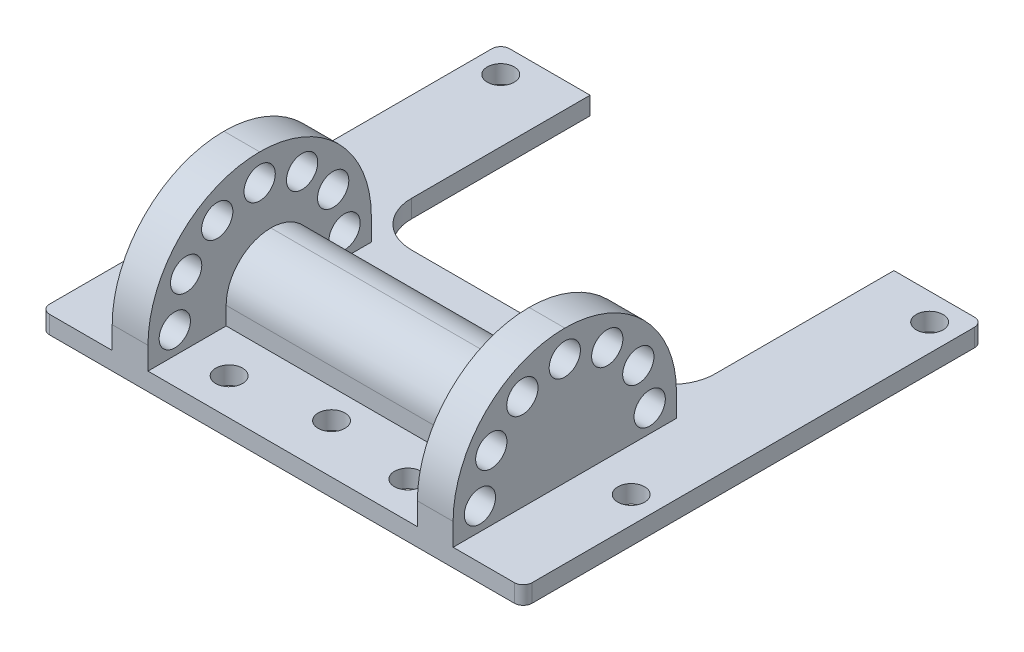
from build123d import *

# Parameters (mm, degrees)
SKETCH1_R                       = 1.5
BOSS_EXTRUDE1_DEPTH             = 2
SKETCH2_W                       = 4
SKETCH2_H                       = 25
BOSS_EXTRUDE2_DEPTH             = 15
FILLET1_R                       = 12.5
SKETCH3_R                       = 1.75
CUT_EXTRUDE3_DEPTH              = 53.391713426
CIRPATTERN1_COUNT               = 4
CIRPATTERN1_ANGLE               = 90
CIRPATTERN1_THE_OTHER_WAY_COUNT = 4
CIRPATTERN1_THE_OTHER_WAY_ANGLE = 90
MIRROR1_COPY_1_SKETCH_R         = 1.75
MIRROR1_COPY_1_DEPTH            = 53.391713426
MIRROR1_COPY_2_SKETCH_R         = 1.75
MIRROR1_COPY_2_DEPTH            = 53.391713426
MIRROR1_COPY_3_SKETCH_R         = 1.75
MIRROR1_COPY_3_DEPTH            = 53.391713426
MIRROR1_COPY_4_SKETCH_R         = 1.75
MIRROR1_COPY_4_DEPTH            = 53.391713426
MIRROR1_COPY_5_SKETCH_R         = 1.75
MIRROR1_COPY_5_DEPTH            = 53.391713426
MIRROR1_COPY_6_SKETCH_R         = 1.75
MIRROR1_COPY_6_DEPTH            = 53.391713426
FILLET1_OF_MIRROR1_R            = 12.5
SKETCH4_W                       = 30.151429758
SKETCH4_H                       = 10
BOSS_EXTRUDE3_DEPTH             = 7
FILLET2_R                       = 5


with BuildPart() as part:
    # Sketch1 → Boss-Extrude1 (new body)
    with BuildSketch(Plane(origin=(0, 0, 0), x_dir=(1, 0, 0), z_dir=(0, 1, 0))):
        with BuildLine():
            Line((-17.075714879, 5.179541619), (-17.075714879, 25.179541619))
            Line((-17.075714879, 25.179541619), (-26.075714879, 25.179541619))
            ThreePointArc((-26.075714879, 25.179541619), (-26.782821661, 24.8866484), (-27.075714879, 24.179541619))
            Line((-27.075714879, 24.179541619), (-27.075714879, -25.303833099))
            ThreePointArc((-27.075714879, -25.303833099), (-26.782821661, -26.010939881), (-26.075714879, -26.303833099))
            Line((-26.075714879, -26.303833099), (25.924285121, -26.303833099))
            ThreePointArc((25.924285121, -26.303833099), (26.631391902, -26.010939881), (26.924285121, -25.303833099))
            Line((26.924285121, -25.303833099), (26.924285121, 24.179541619))
            ThreePointArc((26.924285121, 24.179541619), (26.631391902, 24.8866484), (25.924285121, 25.179541619))
            Line((25.924285121, 25.179541619), (16.924285121, 25.179541619))
            Line((16.924285121, 25.179541619), (16.924285121, 5.179541619))
            ThreePointArc((16.924285121, 5.179541619), (15.459819027, 1.644007713), (11.924285121, 0.179541619))
            Line((11.924285121, 0.179541619), (-12.075714879, 0.179541619))
            ThreePointArc((-12.075714879, 0.179541619), (-15.611248785, 1.644007713), (-17.075714879, 5.179541619))
        make_face()
        with Locations(Location((-24.075714879, 22.179541619, 0), (0, 0, 270))):
            Circle(SKETCH1_R, mode=Mode.SUBTRACT)
        with Locations(Location((23.924285121, 22.179541619, 0), (0, 0, 270))):
            Circle(SKETCH1_R, mode=Mode.SUBTRACT)
        with Locations(Location((-24.075714879, -11.220458381, 0), (0, 0, 270))):
            Circle(SKETCH1_R, mode=Mode.SUBTRACT)
        with Locations(Location((-10.075714879, -22.220458381, 0), (0, 0, 270))):
            Circle(SKETCH1_R, mode=Mode.SUBTRACT)
        with Locations(Location((9.924285121, -22.220458381, 0), (0, 0, 270))):
            Circle(SKETCH1_R, mode=Mode.SUBTRACT)
        with Locations(Location((0, -20.835125629, 0), (0, 0, 270))):
            Circle(SKETCH1_R, mode=Mode.SUBTRACT)
        with Locations(Location((23.924285121, -11.220458381, 0), (0, 0, 270))):
            Circle(SKETCH1_R, mode=Mode.SUBTRACT)
    extrude(amount=BOSS_EXTRUDE1_DEPTH)

    # Sketch2 → Boss-Extrude2 (add)
    with BuildSketch(Plane(origin=(0, 2, 0), x_dir=(1, 0, 0), z_dir=(0, 1, 0))):
        with Locations((-17.075714879, -13.803833099)):
            Rectangle(SKETCH2_W, SKETCH2_H)
    boss_extrude2 = extrude(amount=BOSS_EXTRUDE2_DEPTH)

    # Fillet1
    fillet1_edges = [part.edges().sort_by_distance(p)[0] for p in [
        (-17.075714879, 17, 26.303833099),
        (-17.075714879, 17, 1.303833099),
    ]]
    fillet(fillet1_edges, radius=FILLET1_R - 0.0001)  # a hair under: the kernel refuses the full size

    # Sketch3 → Cut-Extrude3 (cut, through all)
    with BuildSketch(Plane(origin=(-15.075714879, 0, 0), x_dir=(0, 0, -1), z_dir=(1, 0, 0))):
        with Locations((-13.803833099, 14)):
            Circle(SKETCH3_R)
    cut_extrude3 = extrude(amount=-CUT_EXTRUDE3_DEPTH, mode=Mode.SUBTRACT)

    # CirPattern1: Cut-Extrude3 ×4 about axis
    cirpattern1_axis = Axis((0, 4.5, 13.803833099), (1, 0, 0))
    for i in range(1, CIRPATTERN1_COUNT):
        add(cut_extrude3.rotate(cirpattern1_axis, i * CIRPATTERN1_ANGLE / (CIRPATTERN1_COUNT - 1)), mode=Mode.SUBTRACT)

    # CirPattern1 the other way: Cut-Extrude3 ×4 about axis
    cirpattern1_the_other_way_axis = Axis((0, 4.5, 13.803833099), (-1, 0, 0))
    for i in range(1, CIRPATTERN1_THE_OTHER_WAY_COUNT):
        add(cut_extrude3.rotate(cirpattern1_the_other_way_axis, i * CIRPATTERN1_THE_OTHER_WAY_ANGLE / (CIRPATTERN1_THE_OTHER_WAY_COUNT - 1)), mode=Mode.SUBTRACT)

    # Mirror1: Boss-Extrude2, Cut-Extrude3 across plane
    add(boss_extrude2.mirror(Plane(origin=(0, 0, 0), x_dir=(0, 0, 1), z_dir=(1, 0, 0))))
    add(cut_extrude3.mirror(Plane(origin=(0, 0, 0), x_dir=(0, 0, 1), z_dir=(1, 0, 0))), mode=Mode.SUBTRACT)

    # Mirror1 copy 1 sketch → Mirror1 copy 1 (cut, through all)
    with BuildSketch(Plane(origin=(15.075714879, 7.504802233, -0.400637034), x_dir=(0, 0.5000000000000008, -0.8660254037844382), z_dir=(-1, 0, 0))):
        with Locations((-13.803833099, -14)):
            Circle(MIRROR1_COPY_1_SKETCH_R)
    extrude(amount=-MIRROR1_COPY_1_DEPTH, mode=Mode.SUBTRACT)

    # Mirror1 copy 2 sketch → Mirror1 copy 2 (cut, through all)
    with BuildSketch(Plane(origin=(15.075714879, 14.204470134, 3.004802233), x_dir=(0, 0.8660254037844396, -0.4999999999999984), z_dir=(-1, 0, 0))):
        with Locations((-13.803833099, -14)):
            Circle(MIRROR1_COPY_2_SKETCH_R)
    extrude(amount=-MIRROR1_COPY_2_DEPTH, mode=Mode.SUBTRACT)

    # Mirror1 copy 3 sketch → Mirror1 copy 3 (cut, through all)
    with BuildSketch(Plane(origin=(15.075714879, 18.303833099, 9.303833099), x_dir=(0, 1, 0), z_dir=(-1, 0, 0))):
        with Locations((-13.803833099, -14)):
            Circle(MIRROR1_COPY_3_SKETCH_R)
    extrude(amount=-MIRROR1_COPY_3_DEPTH, mode=Mode.SUBTRACT)

    # Mirror1 copy 4 sketch → Mirror1 copy 4 (cut, through all)
    with BuildSketch(Plane(origin=(15.075714879, -6.299030867, 4.099362966), x_dir=(0, -0.5000000000000008, -0.8660254037844382), z_dir=(-1, 0, 0))):
        with Locations((-13.803833099, -14)):
            Circle(MIRROR1_COPY_4_SKETCH_R)
    extrude(amount=-MIRROR1_COPY_4_DEPTH, mode=Mode.SUBTRACT)

    # Mirror1 copy 5 sketch → Mirror1 copy 5 (cut, through all)
    with BuildSketch(Plane(origin=(15.075714879, -9.704470134, 10.799030867), x_dir=(0, -0.8660254037844396, -0.4999999999999984), z_dir=(-1, 0, 0))):
        with Locations((-13.803833099, -14)):
            Circle(MIRROR1_COPY_5_SKETCH_R)
    extrude(amount=-MIRROR1_COPY_5_DEPTH, mode=Mode.SUBTRACT)

    # Mirror1 copy 6 sketch → Mirror1 copy 6 (cut, through all)
    with BuildSketch(Plane(origin=(15.075714879, -9.303833099, 18.303833099), x_dir=(0, -1, 0), z_dir=(-1, 0, 0))):
        with Locations((-13.803833099, -14)):
            Circle(MIRROR1_COPY_6_SKETCH_R)
    extrude(amount=-MIRROR1_COPY_6_DEPTH, mode=Mode.SUBTRACT)

    # Fillet1 of Mirror1
    fillet1_of_mirror1_edges = [part.edges().sort_by_distance(p)[0] for p in [
        (17.075714879, 17, 26.303833099),
        (17.075714879, 17, 1.303833099),
    ]]
    fillet(fillet1_of_mirror1_edges, radius=FILLET1_OF_MIRROR1_R - 0.0001)  # a hair under: the kernel refuses the full size

    # Sketch4 → Boss-Extrude3 (add)
    with BuildSketch(Plane(origin=(0, 2, 0), x_dir=(1, 0, 0), z_dir=(0, 1, 0))):
        with Locations((0, -12.553833099)):
            Rectangle(SKETCH4_W, SKETCH4_H)
    extrude(amount=BOSS_EXTRUDE3_DEPTH)

    # Fillet2
    fillet2_edges = [part.edges().sort_by_distance(p)[0] for p in [
        (0, 9, 17.553833099),
        (0, 9, 7.553833099),
    ]]
    fillet(fillet2_edges, radius=FILLET2_R - 0.0001)  # a hair under: the kernel refuses the full size


solid = part.part
